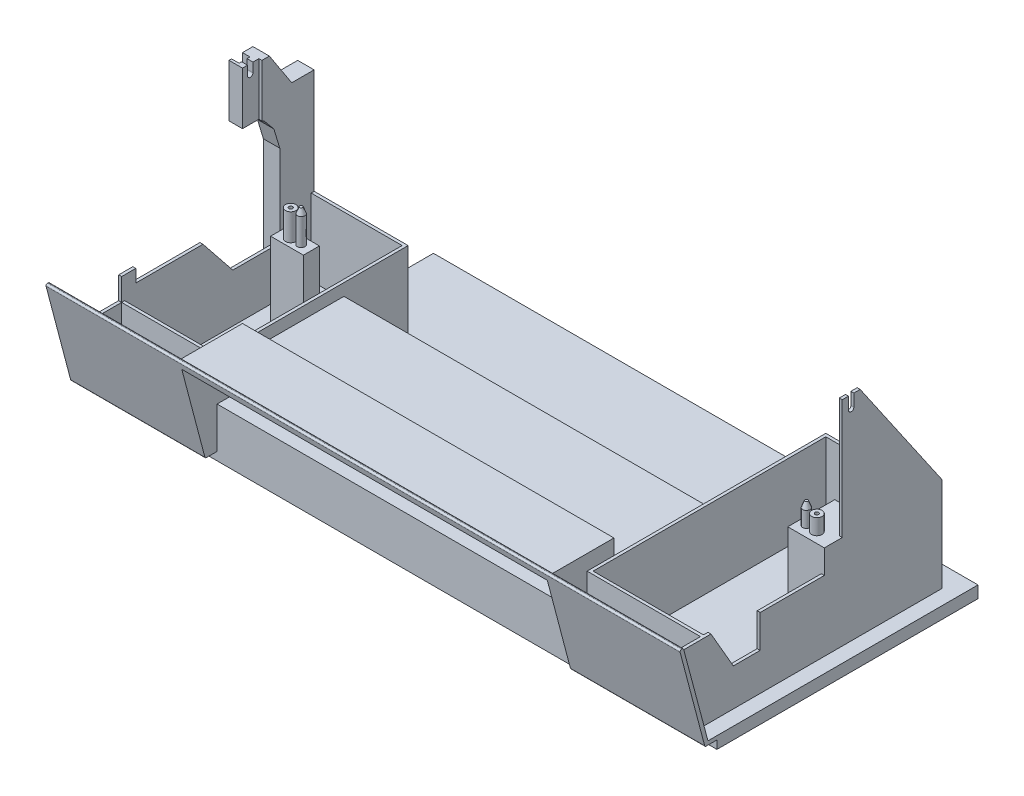
from build123d import *

# Parameters (mm, degrees)
SALIENTE_EXTRUIR3_DEPTH     = 8
CROQUIS4_W                  = 425
CROQUIS4_H                  = 25
SALIENTE_EXTRUIR5_DEPTH     = 70
CORTAR_EXTRUIR5_DEPTH       = 447.465284205
REDONDEO2_R                 = 1
CROQUIS7_W                  = 245
CROQUIS7_H                  = 65
CORTAR_EXTRUIR6_DEPTH       = 25
CROQUIS8_W                  = 245
CROQUIS8_H                  = 23
SALIENTE_EXTRUIR6_DEPTH     = 25
SALIENTE_EXTRUIR7_DEPTH     = 2
SALIENTE_EXTRUIR8_DEPTH     = 2
CROQUIS13_W                 = 41.302313383
CROQUIS13_H                 = 2
SALIENTE_EXTRUIR13_DEPTH    = 245
CROQUIS15_W                 = 78
CROQUIS15_H                 = 160
CROQUIS15_W_2               = 74
CROQUIS15_H_2               = 156
SALIENTE_EXTRUIR15_DEPTH    = 51
CROQUIS16_W                 = 245
CROQUIS16_H                 = 64
SALIENTE_EXTRUIR16_DEPTH    = 43
CROQUIS17_W                 = 2
CROQUIS17_H                 = 68
SALIENTE_EXTRUIR18_DEPTH    = 43
SALIENTE_EXTRUIR21_DEPTH    = 2
CROQUIS20_W                 = 2
CROQUIS20_H                 = 160
SALIENTE_EXTRUIR22_DEPTH    = 100
CORTAR_EXTRUIR7_DEPTH       = 2
CROQUIS22_W                 = 2
CROQUIS22_H                 = 68
SALIENTE_EXTRUIR23_DEPTH    = 43
CROQUIS23_W                 = 65
CROQUIS23_H                 = 129
CROQUIS23_W_2               = 61
CROQUIS23_H_2               = 125
SALIENTE_EXTRUIR24_DEPTH    = 51
SALIENTE_EXTRUIR26_DEPTH    = 2
CROQUIS27_W                 = 2
CROQUIS27_H                 = 129
SALIENTE_EXTRUIR27_DEPTH    = 150
CORTAR_EXTRUIR9_DEPTH       = 2
SALIENTE_EXTRUIR28_DEPTH    = 9
CORTAR_EXTRUIR10_DEPTH      = 1
CORTAR_EXTRUIR10_DEPTH_BACK = 5
CROQUIS33_W                 = 22
CROQUIS33_H                 = 10.7
SALIENTE_EXTRUIR29_DEPTH    = 55.5
CROQUIS34_R                 = 3.5
CROQUIS34_R_2               = 1.25
CROQUIS34_R_3               = 2.5
SALIENTE_EXTRUIR30_DEPTH    = 18
CROQUIS36_W                 = 31.5
CROQUIS36_H                 = 63
SALIENTE_EXTRUIR34_DEPTH    = 22.5
CROQUIS37_R                 = 3.5
CROQUIS37_R_2               = 1.25
CROQUIS37_R_3               = 2.5
SALIENTE_EXTRUIR35_DEPTH    = 10.5
CROQUIS38_R                 = 1
SALIENTE_EXTRUIR36_DEPTH    = 4
CROQUIS39_R                 = 1
SALIENTE_EXTRUIR37_DEPTH    = 4


with BuildPart() as part:
    # Croquis1 → Saliente-Extruir3 (new body)
    with BuildSketch(Plane(origin=(0, 0, 0), x_dir=(1, 0, 0), z_dir=(0, 1, 0))):
        Polygon((-212.5, -92.5), (212.5, -92.5), (212.5, 82.5), (162.5, 82.5), (162.5, 92.5), (-162.5, 92.5), (-162.5, 47.5), (-212.5, 47.5), align=None)
    extrude(amount=SALIENTE_EXTRUIR3_DEPTH)



with BuildPart() as body_2:
    # Croquis4 → Saliente-Extruir5 (new body)
    with BuildSketch(Plane.XZ):
        with Locations((0, 105)):
            Rectangle(CROQUIS4_W, CROQUIS4_H)
    extrude(amount=-SALIENTE_EXTRUIR5_DEPTH)

    # Croquis5 → Cortar-Extruir5 (cut, through all)
    with BuildSketch(Plane.ZY.offset(212.5)):
        Polygon((92.5, 70), (92.5, 8), (98.5, 8), (115, 70), align=None)
        Polygon((100.5, 5.5), (92.5, 5.5), (92.5, 0), (117.5, 0), (117.5, 70), align=None)
    extrude(amount=-CORTAR_EXTRUIR5_DEPTH, mode=Mode.SUBTRACT)

    # Redondeo2
    redondeo2_edges = [body_2.edges().sort_by_distance(p)[0] for p in [
        (0, 70, 117.5),
        (0, 5.5, 100.5),
        (0, 70, 115),
    ]]
    fillet(redondeo2_edges, radius=REDONDEO2_R)

    # Croquis7 → Cortar-Extruir6 (cut)
    with BuildSketch(Plane.XY.offset(92.5)):
        with Locations((0, 32.5)):
            Rectangle(CROQUIS7_W, CROQUIS7_H)
    extrude(amount=CORTAR_EXTRUIR6_DEPTH, mode=Mode.SUBTRACT)


with BuildPart() as part_1:
    add(part.part)

    add(body_2.part)  # Saliente-Extruir6 merges body 2
    # Croquis8 → Saliente-Extruir6 (add)
    with BuildSketch(Plane(origin=(0, 8, 0), x_dir=(1, 0, 0), z_dir=(0, 1, 0))):
        with Locations((0, -81)):
            Rectangle(CROQUIS8_W, CROQUIS8_H)
    extrude(amount=SALIENTE_EXTRUIR6_DEPTH)

    # Croquis9 → Saliente-Extruir7 (add)
    with BuildSketch(Plane.ZY.offset(122.5)):
        Polygon((114.802313383, 69.25717756), (98.5, 8), (73.5, 8), (73.5, 69.25717756), align=None)
    extrude(amount=SALIENTE_EXTRUIR7_DEPTH)

    # Croquis10 → Saliente-Extruir8 (add)
    with BuildSketch(Plane(origin=(122.5, 0, 0), x_dir=(0, 0, -1), z_dir=(1, 0, 0))):
        Polygon((-114.802313383, 69.25717756), (-98.5, 8), (-73.5, 8), (-73.5, 69.25717756), align=None)
    extrude(amount=SALIENTE_EXTRUIR8_DEPTH)

    # Croquis13 → Saliente-Extruir13 (add)
    with BuildSketch(Plane(origin=(-122.5, 0, 0), x_dir=(0, 0, -1), z_dir=(1, 0, 0))):
        with Locations((-94.151156692, 68.25717756)):
            Rectangle(CROQUIS13_W, CROQUIS13_H)
    extrude(amount=SALIENTE_EXTRUIR13_DEPTH)

    # Croquis15 → Saliente-Extruir15 (add)
    with BuildSketch(Plane(origin=(0, 8, 0), x_dir=(1, 0, 0), z_dir=(0, 1, 0))):
        with Locations((163.5, -11.5)):
            Rectangle(CROQUIS15_W, CROQUIS15_H)
        with Locations((163.5, -11.5)):
            Rectangle(CROQUIS15_W_2, CROQUIS15_H_2, mode=Mode.SUBTRACT)
    extrude(amount=SALIENTE_EXTRUIR15_DEPTH)

    # Croquis16 → Saliente-Extruir16 (add)
    with BuildSketch(Plane(origin=(0, 8, 0), x_dir=(1, 0, 0), z_dir=(0, 1, 0))):
        with Locations((0, -37.5)):
            Rectangle(CROQUIS16_W, CROQUIS16_H)
    extrude(amount=SALIENTE_EXTRUIR16_DEPTH)

    # Croquis17 → Saliente-Extruir18 (add)
    with BuildSketch(Plane(origin=(0, 8, 0), x_dir=(1, 0, 0), z_dir=(0, 1, 0))):
        with Locations((123.5, -39.5)):
            Rectangle(CROQUIS17_W, CROQUIS17_H)
    extrude(amount=SALIENTE_EXTRUIR18_DEPTH)

    # Croquis18 → Saliente-Extruir21 (add)
    with BuildSketch(Plane(origin=(202.5, 0, 0), x_dir=(0, 0, -1), z_dir=(1, 0, 0))):
        Polygon((-91.5, 8), (-98.5, 8), (-112.072580645, 59), (-91.5, 59), align=None)
    extrude(amount=-SALIENTE_EXTRUIR21_DEPTH)

    # Croquis20 → Saliente-Extruir22 (add)
    with BuildSketch(Plane(origin=(0, 59, 0), x_dir=(1, 0, 0), z_dir=(0, 1, 0))):
        with Locations((201.5, -11.5)):
            Rectangle(CROQUIS20_W, CROQUIS20_H)
    extrude(amount=SALIENTE_EXTRUIR22_DEPTH)

    # Croquis21 → Cortar-Extruir7 (cut)
    with BuildSketch(Plane(origin=(202.5, 0, 0), x_dir=(0, 0, -1), z_dir=(1, 0, 0))):
        with BuildLine():
            Line((-91.5, 59), (-86.5, 59))
            Line((-86.5, 59), (-71.5, 33))
            Line((-71.5, 33), (-53.5, 33))
            Line((-53.5, 33), (-53.5, 55))
            Line((-53.5, 55), (-10.5, 55))
            Line((-10.5, 55), (-10.5, 71))
            Line((-10.5, 71), (1.5, 71))
            Line((1.5, 71), (1.5, 151))
            Line((1.5, 151), (5.7, 151))
            Line((5.7, 151), (5.7, 142.8))
            ThreePointArc((5.7, 142.8), (7.5, 141), (9.3, 142.8))
            Line((9.3, 142.8), (9.3, 151))
            Line((9.3, 151), (13.5, 151))
            Line((13.5, 151), (68.5, 71))
            Line((68.5, 71), (68.5, 159))
            Line((68.5, 159), (-91.5, 159))
            Line((-91.5, 159), (-91.5, 59))
        make_face()
    extrude(amount=-CORTAR_EXTRUIR7_DEPTH, mode=Mode.SUBTRACT)

    # Croquis22 → Saliente-Extruir23 (add)
    with BuildSketch(Plane(origin=(0, 8, 0), x_dir=(1, 0, 0), z_dir=(0, 1, 0))):
        with Locations((-123.5, -39.5)):
            Rectangle(CROQUIS22_W, CROQUIS22_H)
    extrude(amount=SALIENTE_EXTRUIR23_DEPTH)

    # Croquis23 → Saliente-Extruir24 (add)
    with BuildSketch(Plane(origin=(0, 8, 0), x_dir=(1, 0, 0), z_dir=(0, 1, 0))):
        with Locations((-157, -27)):
            Rectangle(CROQUIS23_W, CROQUIS23_H)
        with Locations((-157, -27)):
            Rectangle(CROQUIS23_W_2, CROQUIS23_H_2, mode=Mode.SUBTRACT)
    extrude(amount=SALIENTE_EXTRUIR24_DEPTH)

    # Croquis26 → Saliente-Extruir26 (add)
    with BuildSketch(Plane.ZY.offset(189.5)):
        Polygon((91.5, 8), (98.5, 8), (112.072580645, 59), (91.5, 59), align=None)
    extrude(amount=-SALIENTE_EXTRUIR26_DEPTH)

    # Croquis27 → Saliente-Extruir27 (add)
    with BuildSketch(Plane(origin=(0, 51, 0), x_dir=(1, 0, 0), z_dir=(0, 1, 0))):
        with Locations((-188.5, -27)):
            Rectangle(CROQUIS27_W, CROQUIS27_H)
    extrude(amount=SALIENTE_EXTRUIR27_DEPTH)

    # Croquis28 → Cortar-Extruir9 (cut)
    with BuildSketch(Plane.ZY.offset(189.5)):
        Polygon((91.5, 74), (82, 74), (82, 65.5), (37, 65.5), (17, 40.5), (-14.5, 40.5), (-14.5, 95.5), (-10.526321509, 108.678894785), (-4.162244055, 116.341763556), (-2.5, 117.313768237), (-2.5, 152.5), (-7.5, 152.5), (-22.5, 129.5), (-37.5, 129.5), (-37.5, 201), (91.5, 201), align=None)
    extrude(amount=-CORTAR_EXTRUIR9_DEPTH, mode=Mode.SUBTRACT)

    # Croquis29 → Saliente-Extruir28 (add)
    with BuildSketch(Plane.ZY.offset(189.5)):
        with BuildLine():
            Line((-14.5, 95.5), (-10.526321509, 108.678894785))
            Line((-10.526321509, 108.678894785), (-4.162244055, 116.341763556))
            Line((-4.162244055, 116.341763556), (-2.5, 117.313768237))
            Line((-2.5, 117.313768237), (8.5, 117.313768237))
            Line((8.5, 117.313768237), (8.5, 152.5))
            Line((8.5, 152.5), (5.1, 152.5))
            Line((5.1, 152.5), (5.1, 146.3))
            ThreePointArc((5.1, 146.3), (3.3, 144.5), (1.5, 146.3))
            Line((1.5, 146.3), (1.5, 152.5))
            Line((1.5, 152.5), (-7.5, 152.5))
            Line((-7.5, 152.5), (-22.5, 129.5))
            Line((-22.5, 129.5), (-37.5, 129.5))
            Line((-37.5, 129.5), (-37.5, 8))
            Line((-37.5, 8), (-14.5, 8))
            Line((-14.5, 8), (-14.5, 95.5))
        make_face()
    extrude(amount=SALIENTE_EXTRUIR28_DEPTH)

    # Croquis30 → Cortar-Extruir10 (cut, two sides: drawn at the far end of the back side and taken through both)
    with BuildSketch(Plane.ZY.offset(198.5).offset(-CORTAR_EXTRUIR10_DEPTH_BACK)):
        with BuildLine():
            Line((1.5, 152.5), (-0.5, 152.5))
            Line((-0.5, 152.5), (-0.5, 146.1))
            Line((-0.5, 146.1), (2.3, 143.3))
            Line((2.3, 143.3), (4.3, 143.3))
            Line((4.3, 143.3), (6.8, 146.1))
            Line((6.8, 146.1), (6.8, 152.5))
            Line((6.8, 152.5), (5.1, 152.5))
            Line((5.1, 152.5), (5.1, 146.3))
            ThreePointArc((5.1, 146.3), (3.3, 144.5), (1.5, 146.3))
            Line((1.5, 146.3), (1.5, 152.5))
        make_face()
    extrude(amount=CORTAR_EXTRUIR10_DEPTH + CORTAR_EXTRUIR10_DEPTH_BACK, mode=Mode.SUBTRACT)

    # Croquis33 → Saliente-Extruir29 (add)
    with BuildSketch(Plane(origin=(0, 8, 0), x_dir=(1, 0, 0), z_dir=(0, 1, 0))):
        with Locations((-160.5, -2.3)):
            Rectangle(CROQUIS33_W, CROQUIS33_H)
    extrude(amount=SALIENTE_EXTRUIR29_DEPTH)

    # Croquis34 → Saliente-Extruir30 (add)
    # profile 1 of 2: a face of its own
    with BuildSketch(Plane(origin=(0, 63.5, 0), x_dir=(1, 0, 0), z_dir=(0, 1, 0))):
        with Locations(Location((-163.4, -2.3, 0), (0, 0, 270))):
            Circle(CROQUIS34_R)
        with Locations(Location((-163.4, -2.3, 0), (0, 0, 270))):
            Circle(CROQUIS34_R_2, mode=Mode.SUBTRACT)
    # profile 2 of 2: a face of its own
    with BuildSketch(Plane(origin=(0, 63.5, 0), x_dir=(1, 0, 0), z_dir=(0, 1, 0))):
        with Locations(Location((-156.4, -2.3, 0), (0, 0, 270))):
            Circle(CROQUIS34_R_3)
    extrude(amount=SALIENTE_EXTRUIR30_DEPTH)

    # Croquis36 → Saliente-Extruir34 (add)
    with BuildSketch(Plane.ZY.offset(-200.5)):
        with Locations((-5.25, 39.5)):
            Rectangle(CROQUIS36_W, CROQUIS36_H)
    extrude(amount=SALIENTE_EXTRUIR34_DEPTH)

    # Croquis37 → Saliente-Extruir35 (add)
    # profile 1 of 2: a face of its own
    with BuildSketch(Plane(origin=(0, 71, 0), x_dir=(1, 0, 0), z_dir=(0, 1, 0))):
        with Locations(Location((190.5, -3.5, 0), (0, 0, 90))):
            Circle(CROQUIS37_R)
        with Locations(Location((190.5, -3.5, 0), (0, 0, 90))):
            Circle(CROQUIS37_R_2, mode=Mode.SUBTRACT)
    # profile 2 of 2: a face of its own
    with BuildSketch(Plane(origin=(0, 71, 0), x_dir=(1, 0, 0), z_dir=(0, 1, 0))):
        with Locations(Location((183.5, -3.5, 0), (0, 0, 90))):
            Circle(CROQUIS37_R_3)
    extrude(amount=SALIENTE_EXTRUIR35_DEPTH)

    # Croquis38 → Saliente-Extruir36 (add)
    with BuildSketch(Plane(origin=(0, 81.5, 0), x_dir=(1, 0, 0), z_dir=(0, 1, 0))):
        with Locations(Location((183.5, -3.5, 0), (0, 0, 270))):
            Circle(CROQUIS38_R)
    extrude(amount=SALIENTE_EXTRUIR36_DEPTH)

    # loft up to a face of the part (recubrir2)
    loft([Face(Wire([part_1.edges().sort_by_distance((184.228968627, 85.5, 2.815452894))[0]])), Face(Wire([part_1.edges().sort_by_distance((181.677578431, 81.5, 5.211367765))[0]]))])

    # Croquis39 → Saliente-Extruir37 (add)
    with BuildSketch(Plane(origin=(0, 81.5, 0), x_dir=(1, 0, 0), z_dir=(0, 1, 0))):
        with Locations(Location((-156.4, -2.3, 0), (0, 0, 270))):
            Circle(CROQUIS39_R)
    extrude(amount=SALIENTE_EXTRUIR37_DEPTH)

    # Recubrir3: read off the stored shape, not the designer's step
    # Recubrir3: loft between two sections, ruled curve by curve
    recubrir3_from = [
        Edge.make_bspline([(-157.885934339, 81.5, 0.289527633), (-161.906879074, 81.5, 3.261396311), (-158.935010396, 81.5, 7.282341046), (-154.914065661, 81.5, 4.310472367), (-150.893120926, 81.5, 1.338603689), (-153.864989604, 81.5, -2.682341046), (-157.885934339, 81.5, 0.289527633)], [0, 0, 0, 0, 0.5, 0.5, 0.5, 1, 1, 1, 1], 3, [1, 0.333333333, 0.333333333, 1, 0.333333333, 0.333333333, 1]),
    ]
    recubrir3_to = [
        Edge.make_bspline([(-156.648689887, 85.5, 1.331416839), (-158.585856209, 85.5, 1.828796613), (-158.088476435, 85.5, 3.765962935), (-156.151310113, 85.5, 3.268583161), (-154.214143791, 85.5, 2.771203387), (-154.711523565, 85.5, 0.834037065), (-156.648689887, 85.5, 1.331416839)], [0, 0, 0, 0, 0.5, 0.5, 0.5, 1, 1, 1, 1], 3, [1, 0.333333333, 0.333333333, 1, 0.333333333, 0.333333333, 1]),
    ]
    recubrir3 = Solid(Shell([*[Face.make_surface_from_curves(recubrir3_from[k], recubrir3_to[k]) for k in range(1)], Face(Wire(recubrir3_from)), Face(Wire(recubrir3_to))]))
    add(recubrir3)


solid = part_1.part
